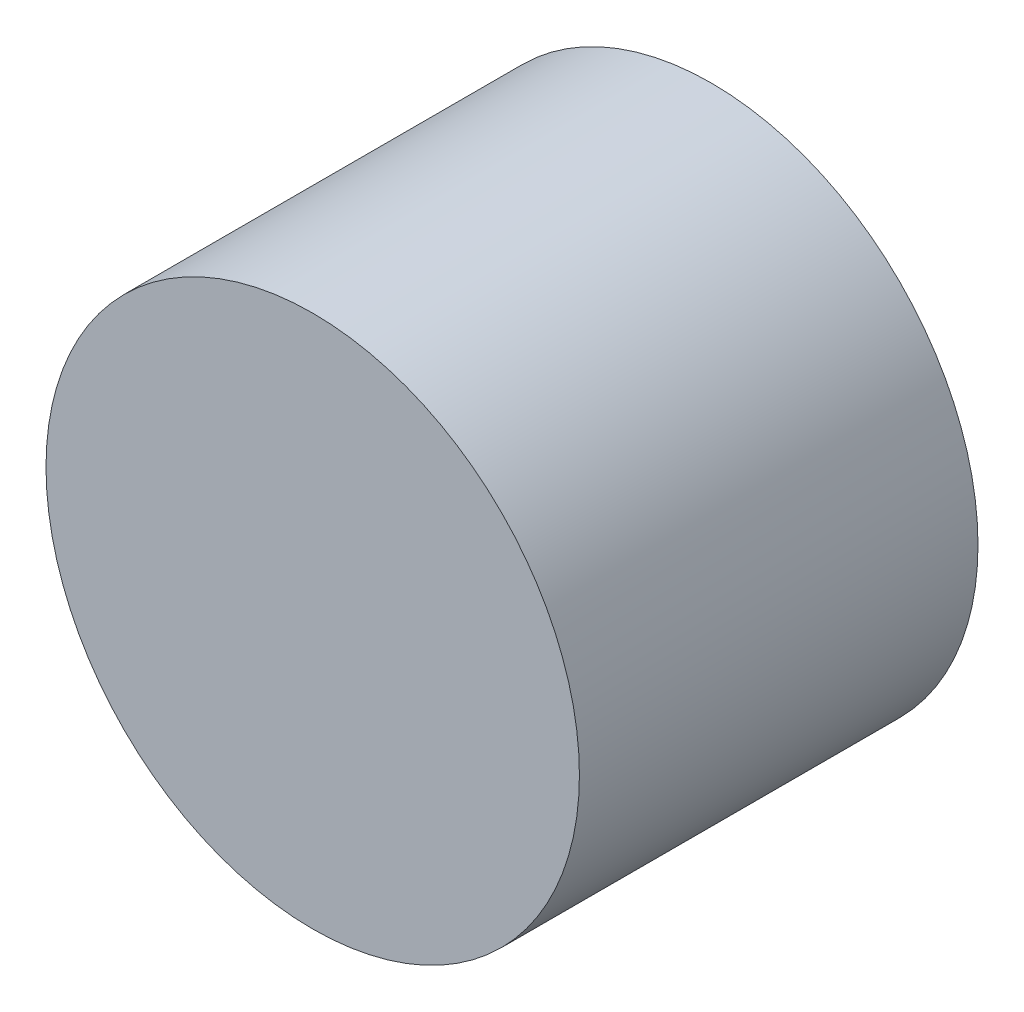
from build123d import *

# Parameters (mm, degrees)
SKETCH1_R           = 4.015
BOSS_EXTRUDE1_DEPTH = 6


with BuildPart() as part:
    # Sketch1 → Boss-Extrude1 (new body)
    with BuildSketch(Plane.XY):
        Circle(SKETCH1_R)
    extrude(amount=BOSS_EXTRUDE1_DEPTH)


solid = part.part
